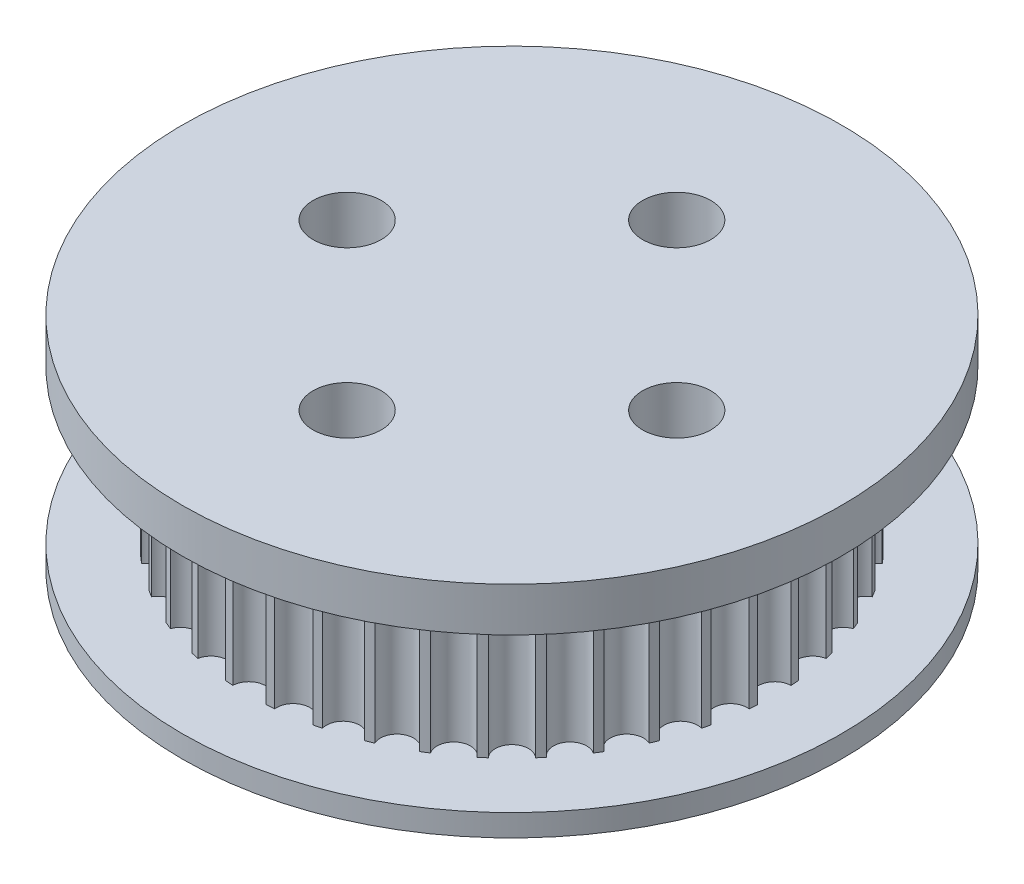
from build123d import *

# Parameters (mm, degrees)
BOSS_EXTRUDE1_DEPTH = 8
SKETCH2_R           = 15
BOSS_EXTRUDE2_DEPTH = 1
MIRROR1_START       = -1
MIRROR1_OUTLINE_R   = 15
MIRROR1_DEPTH       = 1
MIRROR1_START_2     = 7
MIRROR1_2_OUTLINE_R = 15
MIRROR1_2_DEPTH     = 1
SKETCH6_R           = 1.55
CUT_EXTRUDE3_DEPTH  = 24.452078799


# Read off the part's stored shape, not the designer's step: Mirror1
with BuildPart() as part:
    # Sketch1 → Boss-Extrude1 (new body)
    with BuildSketch(Plane(origin=(0, 0, 0), x_dir=(1, 0, 0), z_dir=(0, 1, 0))):
        with BuildLine():
            ThreePointArc((-2.619011045, 11.679969227), (-2.794341005, 11.639267947), (-2.969039138, 11.595934917))
            ThreePointArc((-2.969039138, 11.595934917), (-3.464080507, 10.661343548), (-4.413916411, 11.126465832))
            ThreePointArc((-4.413916411, 11.126465832), (-4.580720685, 11.058838004), (-4.746489215, 10.988709666))
            ThreePointArc((-4.746489215, 10.988709666), (-5.089233502, 9.988183136), (-6.100136506, 10.298991922))
            ThreePointArc((-6.100136506, 10.298991922), (-6.25430782, 10.206102767), (-6.407064974, 10.110905915))
            ThreePointArc((-6.407064974, 10.110905915), (-6.589072678, 9.069080507), (-7.636150994, 9.21792265))
            ThreePointArc((-7.636150994, 9.21792265), (-7.773893139, 9.102059408), (-7.909877531, 8.984138103))
            ThreePointArc((-7.909877531, 8.984138103), (-7.926667017, 7.926667017), (-8.984138103, 7.909877531))
            ThreePointArc((-8.984138103, 7.909877531), (-9.102059408, 7.773893139), (-9.21792265, 7.636150994))
            ThreePointArc((-9.21792265, 7.636150994), (-9.069080507, 6.589072678), (-10.110905915, 6.407064974))
            ThreePointArc((-10.110905915, 6.407064974), (-10.206102767, 6.25430782), (-10.298991922, 6.100136506))
            ThreePointArc((-10.298991922, 6.100136506), (-9.988183136, 5.089233502), (-10.988709666, 4.746489215))
            ThreePointArc((-10.988709666, 4.746489215), (-11.058838004, 4.580720685), (-11.126465832, 4.413916411))
            ThreePointArc((-11.126465832, 4.413916411), (-10.661343548, 3.464080507), (-11.595934917, 2.969039138))
            ThreePointArc((-11.595934917, 2.969039138), (-11.639267947, 2.794341005), (-11.679969227, 2.619011045))
            ThreePointArc((-11.679969227, 2.619011045), (-11.071986298, 1.753630353), (-11.917629765, 1.118481464))
            ThreePointArc((-11.917629765, 1.118481464), (-11.933100485, 0.939155376), (-11.945873016, 0.759616935))
            ThreePointArc((-11.945873016, 0.759616935), (-11.21, 0), (-11.945873016, -0.759616935))
            ThreePointArc((-11.945873016, -0.759616935), (-11.933100485, -0.939155376), (-11.917629765, -1.118481464))
            ThreePointArc((-11.917629765, -1.118481464), (-11.071986298, -1.753630353), (-11.679969227, -2.619011045))
            ThreePointArc((-11.679969227, -2.619011045), (-11.639267947, -2.794341005), (-11.595934917, -2.969039138))
            ThreePointArc((-11.595934917, -2.969039138), (-10.661343548, -3.464080507), (-11.126465832, -4.413916411))
            ThreePointArc((-11.126465832, -4.413916411), (-11.058838004, -4.580720685), (-10.988709666, -4.746489215))
            ThreePointArc((-10.988709666, -4.746489215), (-9.988183136, -5.089233502), (-10.298991922, -6.100136506))
            ThreePointArc((-10.298991922, -6.100136506), (-10.206102767, -6.25430782), (-10.110905915, -6.407064974))
            ThreePointArc((-10.110905915, -6.407064974), (-9.069080507, -6.589072678), (-9.21792265, -7.636150994))
            ThreePointArc((-9.21792265, -7.636150994), (-9.102059408, -7.773893139), (-8.984138103, -7.909877531))
            ThreePointArc((-8.984138103, -7.909877531), (-7.926667017, -7.926667017), (-7.909877531, -8.984138103))
            ThreePointArc((-7.909877531, -8.984138103), (-7.773893139, -9.102059408), (-7.636150994, -9.21792265))
            ThreePointArc((-7.636150994, -9.21792265), (-6.589072678, -9.069080507), (-6.407064974, -10.110905915))
            ThreePointArc((-6.407064974, -10.110905915), (-6.25430782, -10.206102767), (-6.100136506, -10.298991922))
            ThreePointArc((-6.100136506, -10.298991922), (-5.089233502, -9.988183136), (-4.746489215, -10.988709666))
            ThreePointArc((-4.746489215, -10.988709666), (-4.580720685, -11.058838004), (-4.413916411, -11.126465832))
            ThreePointArc((-4.413916411, -11.126465832), (-3.464080507, -10.661343548), (-2.969039138, -11.595934917))
            ThreePointArc((-2.969039138, -11.595934917), (-2.794341005, -11.639267947), (-2.619011045, -11.679969227))
            ThreePointArc((-2.619011045, -11.679969227), (-1.753630353, -11.071986298), (-1.118481464, -11.917629765))
            ThreePointArc((-1.118481464, -11.917629765), (-0.939155376, -11.933100485), (-0.759616935, -11.945873016))
            ThreePointArc((-0.759616935, -11.945873016), (0, -11.21), (0.759616935, -11.945873016))
            ThreePointArc((0.759616935, -11.945873016), (0.939155376, -11.933100485), (1.118481464, -11.917629765))
            ThreePointArc((1.118481464, -11.917629765), (1.753630353, -11.071986298), (2.619011045, -11.679969227))
            ThreePointArc((2.619011045, -11.679969227), (2.794341005, -11.639267947), (2.969039138, -11.595934917))
            ThreePointArc((2.969039138, -11.595934917), (3.464080507, -10.661343548), (4.413916411, -11.126465832))
            ThreePointArc((4.413916411, -11.126465832), (4.580720685, -11.058838004), (4.746489215, -10.988709666))
            ThreePointArc((4.746489215, -10.988709666), (5.089233502, -9.988183136), (6.100136506, -10.298991922))
            ThreePointArc((6.100136506, -10.298991922), (6.25430782, -10.206102767), (6.407064974, -10.110905915))
            ThreePointArc((6.407064974, -10.110905915), (6.589072678, -9.069080507), (7.636150994, -9.21792265))
            ThreePointArc((7.636150994, -9.21792265), (7.773893139, -9.102059408), (7.909877531, -8.984138103))
            ThreePointArc((7.909877531, -8.984138103), (7.926667017, -7.926667017), (8.984138103, -7.909877531))
            ThreePointArc((8.984138103, -7.909877531), (9.102059408, -7.773893139), (9.21792265, -7.636150994))
            ThreePointArc((9.21792265, -7.636150994), (9.069080507, -6.589072678), (10.110905915, -6.407064974))
            ThreePointArc((10.110905915, -6.407064974), (10.206102767, -6.25430782), (10.298991922, -6.100136506))
            ThreePointArc((10.298991922, -6.100136506), (9.988183136, -5.089233502), (10.988709666, -4.746489215))
            ThreePointArc((10.988709666, -4.746489215), (11.058838004, -4.580720685), (11.126465832, -4.413916411))
            ThreePointArc((11.126465832, -4.413916411), (10.661343548, -3.464080507), (11.595934917, -2.969039138))
            ThreePointArc((11.595934917, -2.969039138), (11.639267947, -2.794341005), (11.679969227, -2.619011045))
            ThreePointArc((11.679969227, -2.619011045), (11.071986298, -1.753630353), (11.917629765, -1.118481464))
            ThreePointArc((11.917629765, -1.118481464), (11.933100485, -0.939155376), (11.945873016, -0.759616935))
            ThreePointArc((11.945873016, -0.759616935), (11.21, 0), (11.945873016, 0.759616935))
            ThreePointArc((11.945873016, 0.759616935), (11.933100485, 0.939155376), (11.917629765, 1.118481464))
            ThreePointArc((11.917629765, 1.118481464), (11.071986298, 1.753630353), (11.679969227, 2.619011045))
            ThreePointArc((11.679969227, 2.619011045), (11.639267947, 2.794341005), (11.595934917, 2.969039138))
            ThreePointArc((11.595934917, 2.969039138), (10.661343548, 3.464080507), (11.126465832, 4.413916411))
            ThreePointArc((11.126465832, 4.413916411), (11.058838004, 4.580720685), (10.988709666, 4.746489215))
            ThreePointArc((10.988709666, 4.746489215), (9.988183136, 5.089233502), (10.298991922, 6.100136506))
            ThreePointArc((10.298991922, 6.100136506), (10.206102767, 6.25430782), (10.110905915, 6.407064974))
            ThreePointArc((10.110905915, 6.407064974), (9.069080507, 6.589072678), (9.21792265, 7.636150994))
            ThreePointArc((9.21792265, 7.636150994), (9.102059408, 7.773893139), (8.984138103, 7.909877531))
            ThreePointArc((8.984138103, 7.909877531), (7.926667017, 7.926667017), (7.909877531, 8.984138103))
            ThreePointArc((7.909877531, 8.984138103), (7.773893139, 9.102059408), (7.636150994, 9.21792265))
            ThreePointArc((7.636150994, 9.21792265), (6.589072678, 9.069080507), (6.407064974, 10.110905915))
            ThreePointArc((6.407064974, 10.110905915), (6.25430782, 10.206102767), (6.100136506, 10.298991922))
            ThreePointArc((6.100136506, 10.298991922), (5.089233502, 9.988183136), (4.746489215, 10.988709666))
            ThreePointArc((4.746489215, 10.988709666), (4.580720685, 11.058838004), (4.413916411, 11.126465832))
            ThreePointArc((4.413916411, 11.126465832), (3.464080507, 10.661343548), (2.969039138, 11.595934917))
            ThreePointArc((2.969039138, 11.595934917), (2.794341005, 11.639267947), (2.619011045, 11.679969227))
            ThreePointArc((2.619011045, 11.679969227), (1.753630353, 11.071986298), (1.118481464, 11.917629765))
            ThreePointArc((1.118481464, 11.917629765), (0.939155376, 11.933100485), (0.759616935, 11.945873016))
            ThreePointArc((0.759616935, 11.945873016), (0, 11.21), (-0.759616935, 11.945873016))
            ThreePointArc((-0.759616935, 11.945873016), (-0.939155376, 11.933100485), (-1.118481464, 11.917629765))
            ThreePointArc((-1.118481464, 11.917629765), (-1.753630353, 11.071986298), (-2.619011045, 11.679969227))
        make_face()
    extrude(amount=BOSS_EXTRUDE1_DEPTH)

    # Sketch2 → Boss-Extrude2 (add)
    with BuildSketch(Plane(origin=(0, 8, 0), x_dir=(1, 0, 0), z_dir=(0, 1, 0))):
        with Locations(Location((0, 0, 0), (0, 0, 270))):
            Circle(SKETCH2_R)
    extrude(amount=BOSS_EXTRUDE2_DEPTH)

    # Mirror1 outline → Mirror1 (add)
    with BuildSketch(Plane(origin=(0, 0, 0), x_dir=(1, 0, 0), z_dir=(0, 1, 0)).offset(MIRROR1_START)):
        Circle(MIRROR1_OUTLINE_R)
    extrude(amount=MIRROR1_DEPTH)

    # Mirror1 2 outline → Mirror1 2 (add)
    with BuildSketch(Plane(origin=(0, 0, 0), x_dir=(1, 0, 0), z_dir=(0, 1, 0)).offset(MIRROR1_START_2)):
        Circle(MIRROR1_2_OUTLINE_R)
        with BuildLine():
            ThreePointArc((-10.988709666, 4.746489215), (-9.988183136, 5.089233502), (-10.298991922, 6.100136506))
            ThreePointArc((-10.298991922, 6.100136506), (-10.206102767, 6.254307819), (-10.110905915, 6.407064974))
            ThreePointArc((-10.110905915, 6.407064974), (-9.069080507, 6.589072678), (-9.21792265, 7.636150994))
            ThreePointArc((-9.21792265, 7.636150994), (-9.102059408, 7.773893139), (-8.984138103, 7.909877531))
            ThreePointArc((-8.984138103, 7.909877531), (-7.926667017, 7.926667017), (-7.909877531, 8.984138103))
            ThreePointArc((-7.909877531, 8.984138103), (-7.773893139, 9.102059408), (-7.636150994, 9.21792265))
            ThreePointArc((-7.636150994, 9.21792265), (-6.589072678, 9.069080507), (-6.407064974, 10.110905915))
            ThreePointArc((-6.407064974, 10.110905915), (-6.254307819, 10.206102767), (-6.100136506, 10.298991922))
            ThreePointArc((-6.100136506, 10.298991922), (-5.089233502, 9.988183136), (-4.746489215, 10.988709666))
            ThreePointArc((-4.746489215, 10.988709666), (-4.580720685, 11.058838004), (-4.413916411, 11.126465832))
            ThreePointArc((-4.413916411, 11.126465832), (-3.464080507, 10.661343548), (-2.969039138, 11.595934917))
            ThreePointArc((-2.969039138, 11.595934917), (-2.794341005, 11.639267947), (-2.619011045, 11.679969227))
            ThreePointArc((-2.619011045, 11.679969227), (-1.753630353, 11.071986298), (-1.118481464, 11.917629765))
            ThreePointArc((-1.118481464, 11.917629765), (-0.939155376, 11.933100485), (-0.759616935, 11.945873016))
            ThreePointArc((-0.759616935, 11.945873016), (0, 11.21), (0.759616935, 11.945873016))
            ThreePointArc((0.759616935, 11.945873016), (0.939155376, 11.933100485), (1.118481464, 11.917629765))
            ThreePointArc((1.118481464, 11.917629765), (1.753630353, 11.071986298), (2.619011045, 11.679969227))
            ThreePointArc((2.619011045, 11.679969227), (2.794341005, 11.639267947), (2.969039138, 11.595934917))
            ThreePointArc((2.969039138, 11.595934917), (3.464080507, 10.661343548), (4.413916411, 11.126465832))
            ThreePointArc((4.413916411, 11.126465832), (4.580720685, 11.058838004), (4.746489215, 10.988709666))
            ThreePointArc((4.746489215, 10.988709666), (5.089233502, 9.988183136), (6.100136506, 10.298991922))
            ThreePointArc((6.100136506, 10.298991922), (6.254307819, 10.206102767), (6.407064974, 10.110905915))
            ThreePointArc((6.407064974, 10.110905915), (6.589072678, 9.069080507), (7.636150994, 9.21792265))
            ThreePointArc((7.636150994, 9.21792265), (7.773893139, 9.102059408), (7.909877531, 8.984138103))
            ThreePointArc((7.909877531, 8.984138103), (7.926667017, 7.926667017), (8.984138103, 7.909877531))
            ThreePointArc((8.984138103, 7.909877531), (9.102059408, 7.773893139), (9.21792265, 7.636150994))
            ThreePointArc((9.21792265, 7.636150994), (9.069080507, 6.589072678), (10.110905915, 6.407064974))
            ThreePointArc((10.110905915, 6.407064974), (10.206102767, 6.254307819), (10.298991922, 6.100136506))
            ThreePointArc((10.298991922, 6.100136506), (9.988183136, 5.089233502), (10.988709666, 4.746489215))
            ThreePointArc((10.988709666, 4.746489215), (11.058838004, 4.580720685), (11.126465832, 4.413916411))
            ThreePointArc((11.126465832, 4.413916411), (10.661343548, 3.464080507), (11.595934917, 2.969039138))
            ThreePointArc((11.595934917, 2.969039138), (11.639267947, 2.794341005), (11.679969227, 2.619011045))
            ThreePointArc((11.679969227, 2.619011045), (11.071986298, 1.753630353), (11.917629765, 1.118481464))
            ThreePointArc((11.917629765, 1.118481464), (11.933100485, 0.939155376), (11.945873016, 0.759616935))
            ThreePointArc((11.945873016, 0.759616935), (11.21, 0), (11.945873016, -0.759616935))
            ThreePointArc((11.945873016, -0.759616935), (11.933100485, -0.939155376), (11.917629765, -1.118481464))
            ThreePointArc((11.917629765, -1.118481464), (11.071986298, -1.753630353), (11.679969227, -2.619011045))
            ThreePointArc((11.679969227, -2.619011045), (11.639267947, -2.794341005), (11.595934917, -2.969039138))
            ThreePointArc((11.595934917, -2.969039138), (10.661343548, -3.464080507), (11.126465832, -4.413916411))
            ThreePointArc((11.126465832, -4.413916411), (11.058838004, -4.580720685), (10.988709666, -4.746489215))
            ThreePointArc((10.988709666, -4.746489215), (9.988183136, -5.089233502), (10.298991922, -6.100136506))
            ThreePointArc((10.298991922, -6.100136506), (10.206102767, -6.254307819), (10.110905915, -6.407064974))
            ThreePointArc((10.110905915, -6.407064974), (9.069080507, -6.589072678), (9.21792265, -7.636150994))
            ThreePointArc((9.21792265, -7.636150994), (9.102059408, -7.773893139), (8.984138103, -7.909877531))
            ThreePointArc((8.984138103, -7.909877531), (7.926667017, -7.926667017), (7.909877531, -8.984138103))
            ThreePointArc((7.909877531, -8.984138103), (7.773893139, -9.102059408), (7.636150994, -9.21792265))
            ThreePointArc((7.636150994, -9.21792265), (6.589072678, -9.069080507), (6.407064974, -10.110905915))
            ThreePointArc((6.407064974, -10.110905915), (6.254307819, -10.206102767), (6.100136506, -10.298991922))
            ThreePointArc((6.100136506, -10.298991922), (5.089233502, -9.988183136), (4.746489215, -10.988709666))
            ThreePointArc((4.746489215, -10.988709666), (4.580720685, -11.058838004), (4.413916411, -11.126465832))
            ThreePointArc((4.413916411, -11.126465832), (3.464080507, -10.661343548), (2.969039138, -11.595934917))
            ThreePointArc((2.969039138, -11.595934917), (2.794341005, -11.639267947), (2.619011045, -11.679969227))
            ThreePointArc((2.619011045, -11.679969227), (1.753630353, -11.071986298), (1.118481464, -11.917629765))
            ThreePointArc((1.118481464, -11.917629765), (0.939155376, -11.933100485), (0.759616935, -11.945873016))
            ThreePointArc((0.759616935, -11.945873016), (0, -11.21), (-0.759616935, -11.945873016))
            ThreePointArc((-0.759616935, -11.945873016), (-0.939155376, -11.933100485), (-1.118481464, -11.917629765))
            ThreePointArc((-1.118481464, -11.917629765), (-1.753630353, -11.071986298), (-2.619011045, -11.679969227))
            ThreePointArc((-2.619011045, -11.679969227), (-2.794341005, -11.639267947), (-2.969039138, -11.595934917))
            ThreePointArc((-2.969039138, -11.595934917), (-3.464080507, -10.661343548), (-4.413916411, -11.126465832))
            ThreePointArc((-4.413916411, -11.126465832), (-4.580720685, -11.058838004), (-4.746489215, -10.988709666))
            ThreePointArc((-4.746489215, -10.988709666), (-5.089233502, -9.988183136), (-6.100136506, -10.298991922))
            ThreePointArc((-6.100136506, -10.298991922), (-6.254307819, -10.206102767), (-6.407064974, -10.110905915))
            ThreePointArc((-6.407064974, -10.110905915), (-6.589072678, -9.069080507), (-7.636150994, -9.21792265))
            ThreePointArc((-7.636150994, -9.21792265), (-7.773893139, -9.102059408), (-7.909877531, -8.984138103))
            ThreePointArc((-7.909877531, -8.984138103), (-7.926667017, -7.926667017), (-8.984138103, -7.909877531))
            ThreePointArc((-8.984138103, -7.909877531), (-9.102059408, -7.773893139), (-9.21792265, -7.636150994))
            ThreePointArc((-9.21792265, -7.636150994), (-9.069080507, -6.589072678), (-10.110905915, -6.407064974))
            ThreePointArc((-10.110905915, -6.407064974), (-10.206102767, -6.254307819), (-10.298991922, -6.100136506))
            ThreePointArc((-10.298991922, -6.100136506), (-9.988183136, -5.089233502), (-10.988709666, -4.746489215))
            ThreePointArc((-10.988709666, -4.746489215), (-11.058838004, -4.580720685), (-11.126465832, -4.413916411))
            ThreePointArc((-11.126465832, -4.413916411), (-10.661343548, -3.464080507), (-11.595934917, -2.969039138))
            ThreePointArc((-11.595934917, -2.969039138), (-11.639267947, -2.794341005), (-11.679969227, -2.619011045))
            ThreePointArc((-11.679969227, -2.619011045), (-11.071986298, -1.753630353), (-11.917629765, -1.118481464))
            ThreePointArc((-11.917629765, -1.118481464), (-11.933100485, -0.939155376), (-11.945873016, -0.759616935))
            ThreePointArc((-11.945873016, -0.759616935), (-11.21, 0), (-11.945873016, 0.759616935))
            ThreePointArc((-11.945873016, 0.759616935), (-11.933100485, 0.939155376), (-11.917629765, 1.118481464))
            ThreePointArc((-11.917629765, 1.118481464), (-11.071986298, 1.753630353), (-11.679969227, 2.619011045))
            ThreePointArc((-11.679969227, 2.619011045), (-11.639267947, 2.794341005), (-11.595934917, 2.969039138))
            ThreePointArc((-11.595934917, 2.969039138), (-10.661343548, 3.464080507), (-11.126465832, 4.413916411))
            ThreePointArc((-11.126465832, 4.413916411), (-11.058838004, 4.580720685), (-10.988709666, 4.746489215))
        make_face(mode=Mode.SUBTRACT)
    extrude(amount=MIRROR1_2_DEPTH)

    # Sketch6 → Cut-Extrude3 (cut, through all)
    with BuildSketch(Plane.XZ.offset(1)):
        with Locations(Location((7.5, 0, 0), (0, 0, 270))):
            Circle(SKETCH6_R)
        with Locations(Location((0, -7.5, 0), (0, 0, 270))):
            Circle(SKETCH6_R)
        with Locations(Location((-7.5, 0, 0), (0, 0, 270))):
            Circle(SKETCH6_R)
        with Locations(Location((0, 7.5, 0), (0, 0, 270))):
            Circle(SKETCH6_R)
    extrude(amount=-CUT_EXTRUDE3_DEPTH, mode=Mode.SUBTRACT)


solid = part.part
